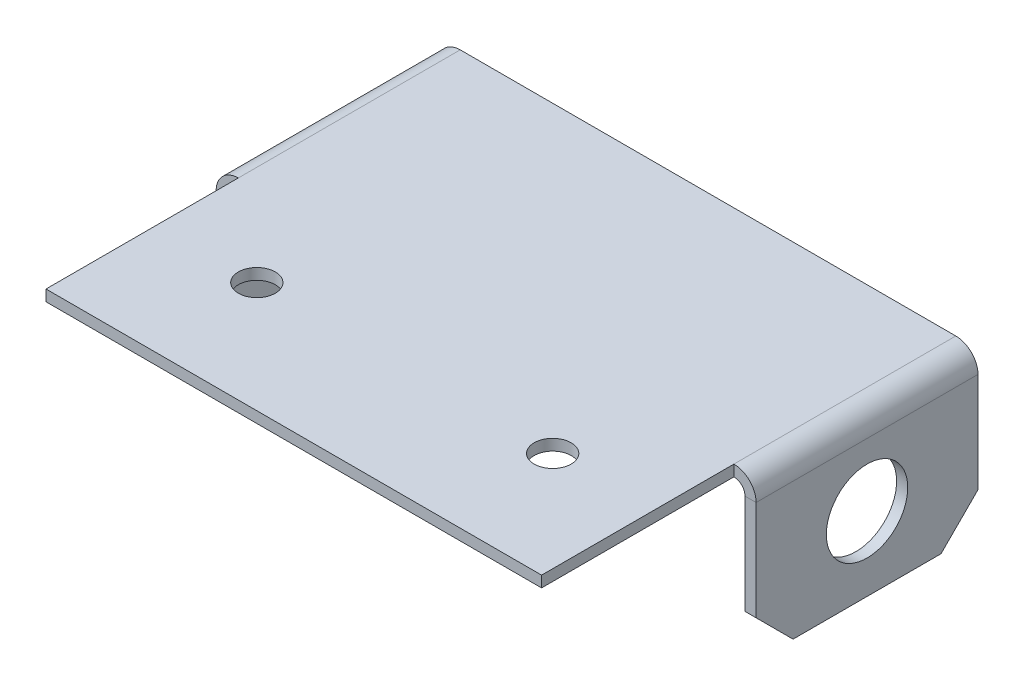
from build123d import *

# Parameters (mm, degrees)
SM_BASE_FLANGE_1_DEPTH   = 15
OTHER_START              = -24.748737342
OTHER_1_OUTLINE_W        = 1.5
OTHER_1_OUTLINE_H        = 23.213203436
OTHER_1_DEPTH            = 3.535533906
OTHER_START_2            = -7.071067812
OTHER_1_2_OUTLINE_W      = 1.5
OTHER_1_2_OUTLINE_H      = 3.786796564
OTHER_1_2_DEPTH          = 7.071067812
SKETCH_6_R               = 5.5
CUT_EXTRUDE_734_DEPTH    = 78.162166896
SKETCH_8_W               = 67
SKETCH_8_H               = 26
SM_BASE_FLANGE_1_2_DEPTH = 1.5
SKETCH_7_R               = 2.5
CUT_EXTRUDE_2_DEPTH      = 10


# Read off the part's stored shape, not the designer's step: Затупленный угол1
# Sheet-metal steps are written as plain solids
with BuildPart() as part:
    # Sketch 1 → Sm Base Flange 1 (new, symmetric)
    with BuildSketch(Plane.XY):
        with BuildLine():
            Line((-35, -20), (-35, -1.5))
            ThreePointArc((-35, -1.5), (-34.560660172, -0.439339828), (-33.5, 0))
            Line((-33.5, 0), (33.5, 0))
            ThreePointArc((33.5, 0), (34.560660172, -0.439339828), (35, -1.5))
            Line((35, -1.5), (35, -20))
            Line((35, -20), (36.5, -20))
            Line((36.5, -20), (36.5, -1.5))
            ThreePointArc((36.5, -1.5), (35.621320344, 0.621320344), (33.5, 1.5))
            Line((33.5, 1.5), (-33.5, 1.5))
            ThreePointArc((-33.5, 1.5), (-35.621320344, 0.621320344), (-36.5, -1.5))
            Line((-36.5, -1.5), (-36.5, -20))
            Line((-36.5, -20), (-35, -20))
        make_face()
    extrude(amount=SM_BASE_FLANGE_1_DEPTH, both=True)

    # Other 1 outline → Other 1 (cut)
    with BuildSketch(Plane(origin=(0, 0, 0), x_dir=(1, 0, 0), z_dir=(0, 0.707106781186548, -0.707106781186547)).offset(OTHER_START)):
        with Locations((-35.75, 9.606601718)):
            Rectangle(OTHER_1_OUTLINE_W, OTHER_1_OUTLINE_H)
        with Locations((35.75, 9.606601718)):
            Rectangle(OTHER_1_OUTLINE_W, OTHER_1_OUTLINE_H)
    extrude(amount=OTHER_1_DEPTH, mode=Mode.SUBTRACT)

    # Other 1 2 outline → Other 1 2 (cut)
    with BuildSketch(Plane(origin=(0, 0, 0), x_dir=(1, 0, 0), z_dir=(0, 0.707106781186548, -0.707106781186547)).offset(OTHER_START_2)):
        with Locations((-35.75, 23.106601718)):
            Rectangle(OTHER_1_2_OUTLINE_W, OTHER_1_2_OUTLINE_H)
        with Locations((35.75, 23.106601718)):
            Rectangle(OTHER_1_2_OUTLINE_W, OTHER_1_2_OUTLINE_H)
    extrude(amount=OTHER_1_2_DEPTH, mode=Mode.SUBTRACT)

    # Эскиз6 → Cut-Extrude 734 (cut, through all)
    with BuildSketch(Plane.ZY.offset(36.5)):
        with Locations((0, -10)):
            Circle(SKETCH_6_R)
    extrude(amount=-CUT_EXTRUDE_734_DEPTH, mode=Mode.SUBTRACT)

    # Эскиз8 → Sm Base Flange 1 2 (add)
    with BuildSketch(Plane(origin=(0, 1.5, 0), x_dir=(1, 0, 0), z_dir=(0, 1, 0))):
        with Locations((0, -28)):
            Rectangle(SKETCH_8_W, SKETCH_8_H)
    extrude(amount=-SM_BASE_FLANGE_1_2_DEPTH)

    # Эскиз7 → Вырез-Вытянуть2 (cut)
    with BuildSketch(Plane(origin=(0, 1.5, 0), x_dir=(1, 0, 0), z_dir=(0, 1, 0))):
        with Locations(Location((-20, -26, 0), (0, 0, 270))):
            Circle(SKETCH_7_R)
        with Locations(Location((20, -26, 0), (0, 0, 90))):
            Circle(SKETCH_7_R)
    extrude(amount=-CUT_EXTRUDE_2_DEPTH, mode=Mode.SUBTRACT)


solid = part.part
